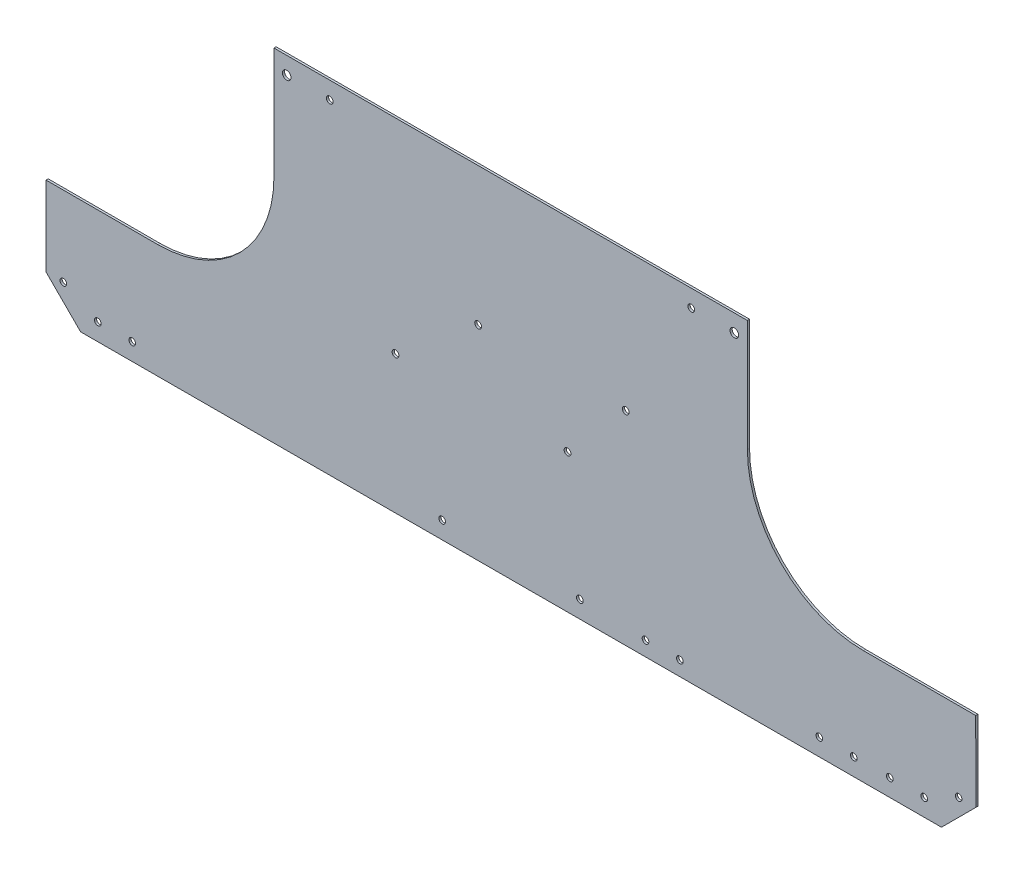
from build123d import *

# Parameters (mm, degrees)
SKETCH3_W                    = 914.4
SKETCH3_H                    = 609.6
BOSS_EXTRUDE1_DEPTH          = 0.79375
SKETCH4_OUTSIDE_W            = 1136.194
SKETCH4_OUTSIDE_H            = 831.394
CUT_EXTRUDE1_DEPTH           = 2.54
F_10_0_1935_DIAMETER_HOLE1_D = 4.9149
CUT_EXTRUDE5_DEPTH           = 2.54
CUT_EXTRUDE6_DEPTH           = 2.54
F_1_4_0_25_DIAMETER_HOLE1_D  = 6.35
F_10_CLEARANCE_HOLE1_D       = 4.9784


with BuildPart() as part:
    # Sketch3 → Boss-Extrude1 (new, symmetric)
    with BuildSketch(Plane.XY):
        Rectangle(SKETCH3_W, SKETCH3_H)
    extrude(amount=BOSS_EXTRUDE1_DEPTH, both=True)

    # Sketch4 outside → Cut-Extrude1 (cut)
    with BuildSketch(Plane.XY.offset(0.79375)):
        Rectangle(SKETCH4_OUTSIDE_W, SKETCH4_OUTSIDE_H)
        with BuildLine():
            Line((-362.506554298, 0.447439942), (318.21252852, 1.564886415))
            ThreePointArc((318.21252852, 1.564886415), (320.009798565, 0.823886977), (320.756694674, -0.970940586))
            Line((320.756694674, -0.970940586), (321.125317657, -225.526391983))
            Line((321.125317657, -225.526391983), (295.766909962, -250.884799679))
            Line((295.766909962, -250.884799679), (-339.232233443, -251.927193706))
            Line((-339.232233443, -251.927193706), (-364.674032102, -226.485395047))
            Line((-364.674032102, -226.485395047), (-365.0423813, -2.096726212))
            ThreePointArc((-365.0423813, -2.096726212), (-364.301381862, -0.299456167), (-362.506554298, 0.447439942))
        make_face(mode=Mode.SUBTRACT)
    extrude(amount=-CUT_EXTRUDE1_DEPTH, mode=Mode.SUBTRACT)

    # #10 (0.1935) Diameter Hole1 (through all)
    with Locations(Plane.XY.offset(0.79375)):
        with Locations((-301.153133674, -239.164667177), (-326.553099451, -239.206362941), (-351.97391311, -226.548075817), (-72.553441175, -238.789405326), (29.046421932, -238.622622281), (77.43654747, -240.486594059), (102.836513247, -240.444898294), (205.703184417, -238.332628273), (231.103150194, -238.290932508), (257.646113416, -238.247360435), (283.046079193, -238.205664671), (308.425197087, -225.463986018), (-155.475985843, -11.912722419), (111.223655321, -11.474916927)):
            Hole(F_10_0_1935_DIAMETER_HOLE1_D / 2)

    # Sketch13 → Cut-Extrude5 (cut)
    with BuildSketch(Plane(origin=(0, 0, -0.79375), x_dir=(-1, 0, 0), z_dir=(0, 0, -1))):
        with BuildLine():
            Line((-152.613233115, -81.22058342), (-152.613233115, 23.518073908))
            Line((-152.613233115, 23.518073908), (-342.941011359, 23.830509847))
            Line((-342.941011359, 23.830509847), (-343.254011981, -166.841258451))
            Line((-343.254011981, -166.841258451), (-238.233908146, -166.841258451))
            ThreePointArc((-238.233908146, -166.841258451), (-177.690948222, -141.763543344), (-152.613233115, -81.22058342))
        make_face()
    extrude(amount=-CUT_EXTRUDE5_DEPTH, mode=Mode.SUBTRACT)

    # Sketch12 → Cut-Extrude6 (cut)
    with BuildSketch(Plane(origin=(0, 0, -0.79375), x_dir=(-1, 0, 0), z_dir=(0, 0, -1))):
        with BuildLine():
            Line((196.636236426, 20.404753749), (384.763838571, 20.095930202))
            Line((384.763838571, 20.095930202), (384.455565363, -167.696021617))
            Line((384.455565363, -167.696021617), (282.223155875, -167.696021617))
            ThreePointArc((282.223155875, -167.696021617), (221.689410489, -142.471662195), (196.636236426, -81.866867765))
            Line((196.636236426, -81.866867765), (196.636236426, 20.404753749))
        make_face()
    extrude(amount=-CUT_EXTRUDE6_DEPTH, mode=Mode.SUBTRACT)

    # 1/4 (0.25) Diameter Hole1 (through all)
    with Locations(Plane(origin=(0, 0, -0.79375), x_dir=(-1, 0, 0), z_dir=(0, 0, -1))):
        with Locations((-142.973612542, -11.422797239), (187.225942556, -11.964842173)):
            Hole(F_1_4_0_25_DIAMETER_HOLE1_D / 2)

    # #10 Clearance Hole1 (through all)
    with Locations(Plane(origin=(0, 0, -0.79375), x_dir=(-1, 0, 0), z_dir=(0, 0, -1))):
        with Locations((-62.885205352, -101.186991996), (-19.917204705, -149.007237749), (46.027185416, -100.817324835), (106.973826127, -149.761638685)):
            Hole(F_10_CLEARANCE_HOLE1_D / 2)


solid = part.part
